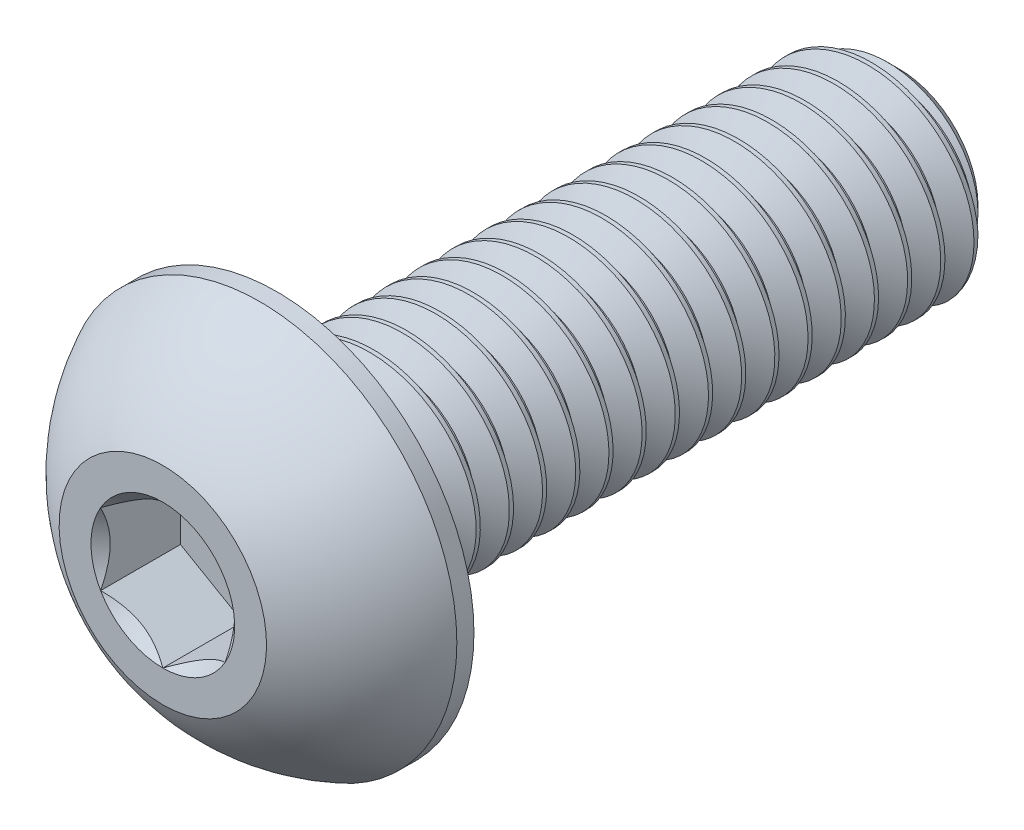
from build123d import *

# Parameters (mm, degrees)
CUT_EXTRUDE2_DEPTH = 1.925
CUT_SWEEP2_PITCH   = 0.8
CUT_SWEEP2_TO      = 15


with BuildPart() as part:
    # Sketch10 → Revolve3 (revolve)
    with BuildSketch(Plane(origin=(0, 0, 0), x_dir=(0, 0, -1), z_dir=(1, 0, 0)), mode=Mode.PRIVATE) as revolve3_sk:
        Polygon((17.15, 2.5), (17.75, 1.9), (17.75, 0), (2.75, 0), (2.75, 2.5), align=None)
    revolve(revolve3_sk.sketch.rotate(Axis((0, 0, 0), (0, 0, -1)), 90), axis=Axis((0, 0, 0), (0, 0, -1)))

    # Sketch7 → Revolve2 (revolve)
    with BuildSketch(Plane(origin=(0, 0, 0), x_dir=(0, 0, -1), z_dir=(1, 0, 0)), mode=Mode.PRIVATE) as revolve2_sk:
        with BuildLine():
            Line((2.3375, 4.75), (2.75, 4.75))
            Line((2.75, 4.75), (2.75, 0))
            Line((2.75, 0), (0, 0))
            Line((0, 0), (0, 2.5))
            ThreePointArc((0, 2.5), (0.991875183, 3.808753282), (2.3375, 4.75))
        make_face()
    revolve(revolve2_sk.sketch.rotate(Axis((0, 0, 0), (0, 0, -1)), 180), axis=Axis((0, 0, 0), (0, 0, -1)))

    # Sketch5 → Cut-Extrude2 (cut)
    with BuildSketch(Plane.XY):
        Polygon((1.5, -0.866025404), (1.5, 0.866025404), (0, 1.732050808), (-1.5, 0.866025404), (-1.5, -0.866025404), (0, -1.732050808), align=None)
    extrude(amount=-CUT_EXTRUDE2_DEPTH, mode=Mode.SUBTRACT)

    # Cut-Extrude3 cone 1 section (through the dimple's axis) → Cut-Extrude3 (revolve, cut)
    with BuildSketch(Plane(origin=(0, 0, 0), x_dir=(0, -1, 0), z_dir=(1, 0, 0))):
        Polygon((0, 0), (1.732050808, 0), (0, 1.732050808), align=None)
    revolve(axis=Axis((0, 0, 0), (0, 0, -1)), mode=Mode.SUBTRACT)


with BuildPart() as body_2:
    # Split1: read off the stored shape, not the designer's step
    # Split1: the piece on the far side of the plane
    add(part.part)
    split(bisect_by=Plane.XY.offset(-2.75), keep=Keep.BOTTOM)

    # Cut-Sweep2: arcs per turn and ends read off the stored shape
    # Cut-Sweep2: the profile of Sketch12 screwed along a right-hand helix through 22.1875 turns, 8 arcs to a turn; built about Z, then put on its axis
    cut_sweep2_z = Axis((0, 0, 0), (0, 0, 1))
    cut_sweep2_corners = [(1.980384758, 0, -0.3), (1.980384758, 0, -0.4), (2.54330127, 0, -0.725), (2.54330127, 0, 0.025)]
    with BuildLine(mode=Mode.PRIVATE) as cut_sweep2_profile:
        Line(cut_sweep2_corners[0], cut_sweep2_corners[1])
        Line(cut_sweep2_corners[1], cut_sweep2_corners[2])
        Line(cut_sweep2_corners[2], cut_sweep2_corners[3])
        Line(cut_sweep2_corners[3], cut_sweep2_corners[0])
    cut_sweep2_cap = Face(cut_sweep2_profile.wire())
    cut_sweep2_turn_angles = [0, 22.5, 45, 67.5, 90, 112.5, 135, 157.5, 180, 202.5, 225, 247.5, 270, 292.5, 315, 337.5, 360]
    cut_sweep2_turn_weights = [1, 0.9238795325112867, 1, 0.9238795325112867, 1, 0.9238795325112867, 1, 0.9238795325112867, 1, 0.9238795325112867, 1, 0.9238795325112867, 1, 0.9238795325112867, 1, 0.9238795325112867, 1]
    cut_sweep2_turn_rails = [Edge.make_bspline([Vector(p[0], p[1], 0).rotate(cut_sweep2_z, cut_sweep2_turn_angles[k]) / cut_sweep2_turn_weights[k] + Vector(0, 0, p[2] + CUT_SWEEP2_PITCH * cut_sweep2_turn_angles[k] / 360) for k in range(17)], [0, 0, 0, 1, 1, 2, 2, 3, 3, 4, 4, 5, 5, 6, 6, 7, 7, 8, 8, 8], 2, cut_sweep2_turn_weights) for p in cut_sweep2_corners]
    cut_sweep2_turn_sides = [Face.make_surface_from_curves(cut_sweep2_turn_rails[p[0]], cut_sweep2_turn_rails[p[1]]) for p in [(0, 1), (1, 2), (2, 3), (3, 0)]]
    cut_sweep2_last_angles = [7920, 7942.5, 7965, 7976.25, 7987.5]
    cut_sweep2_last_weights = [1, 0.9238795325112867, 1, 0.9807852804032258, 1]
    cut_sweep2_last_rails = [Edge.make_bspline([Vector(p[0], p[1], 0).rotate(cut_sweep2_z, cut_sweep2_last_angles[k]) / cut_sweep2_last_weights[k] + Vector(0, 0, p[2] + CUT_SWEEP2_PITCH * cut_sweep2_last_angles[k] / 360) for k in range(5)], [0, 0, 0, 1, 1, 2, 2, 2], 2, cut_sweep2_last_weights) for p in cut_sweep2_corners]
    cut_sweep2_last_sides = [Face.make_surface_from_curves(cut_sweep2_last_rails[p[0]], cut_sweep2_last_rails[p[1]]) for p in [(0, 1), (1, 2), (2, 3), (3, 0)]]
    cut_sweep2 = Plane(origin=(0, 0, -17.75), x_dir=(0, 1, 0), z_dir=(0, 0, 1)) * split(Solid(Shell([*[p.moved(Location((0, 0, CUT_SWEEP2_PITCH * i))) for i in range(22) for p in cut_sweep2_turn_sides], *cut_sweep2_last_sides, cut_sweep2_cap, cut_sweep2_cap.rotate(cut_sweep2_z, 7987.5).moved(Location((0, 0, CUT_SWEEP2_PITCH * 7987.5 / 360)))])), bisect_by=Plane.XY.offset(CUT_SWEEP2_TO), keep=Keep.BOTTOM, mode=Mode.PRIVATE)
    add(cut_sweep2, mode=Mode.SUBTRACT)


with BuildPart() as part_1:
    add(part.part)

    # Split1
    split(bisect_by=Plane.XY.offset(-2.75), keep=Keep.TOP)

    add(body_2.part)  # Boss-Extrude1 merges body 2
    # Boss-Extrude1 cone 1 section (through the dimple's axis) → Boss-Extrude1 (revolve)
    with BuildSketch(Plane(origin=(0, 0, -2.75), x_dir=(0, -1, 0), z_dir=(1, 0, 0))):
        Polygon((0, 0), (2.5, 0), (0, 2.5), align=None)
    revolve(axis=Axis((0, 0, -2.75), (0, 0, -1)))


solid = part_1.part
